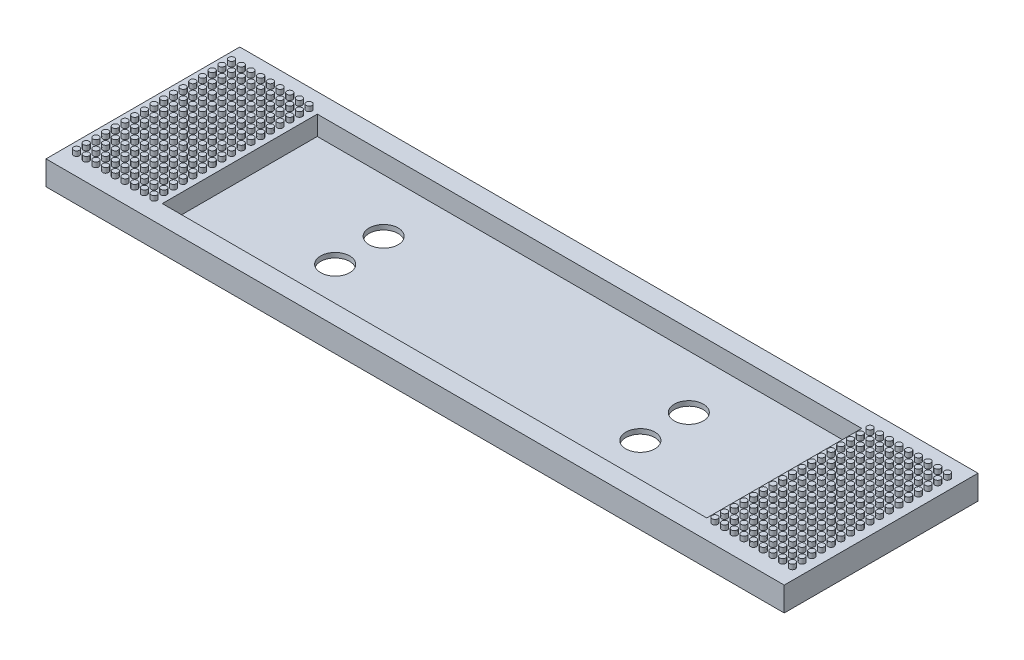
from build123d import *

# Parameters (mm, degrees)
SKETCH1_W           = 193.548
SKETCH1_H           = 50.8
BOSS_EXTRUDE1_DEPTH = 6.35
SKETCH4_W           = 142.748
SKETCH4_H           = 40.64
CUT_EXTRUDE2_DEPTH  = 5.08
SKETCH5_R           = 0.762
BOSS_EXTRUDE2_DEPTH = 1.27
SKETCH6_R           = 3.81
CUT_EXTRUDE3_DEPTH  = 201.248677159


with BuildPart() as part:
    # Sketch1 → Boss-Extrude1 (new body)
    with BuildSketch(Plane(origin=(0, 0, 0), x_dir=(1, 0, 0), z_dir=(0, 1, 0))):
        with Locations((96.774, 25.4)):
            Rectangle(SKETCH1_W, SKETCH1_H)
    extrude(amount=BOSS_EXTRUDE1_DEPTH)

    # Sketch4 → Cut-Extrude2 (cut)
    with BuildSketch(Plane(origin=(0, 6.35, 0), x_dir=(1, 0, 0), z_dir=(0, 1, 0))):
        with Locations((96.774, 25.4)):
            Rectangle(SKETCH4_W, SKETCH4_H)
    extrude(amount=-CUT_EXTRUDE2_DEPTH, mode=Mode.SUBTRACT)

    # Sketch5 → Boss-Extrude2 (add)
    with BuildSketch(Plane(origin=(0, 6.35, 0), x_dir=(1, 0, 0), z_dir=(0, 1, 0))):
        with Locations((2.937134126, 45.72)):
            Circle(SKETCH5_R)
        with Locations((5.477134126, 45.72)):
            Circle(SKETCH5_R)
        with Locations((8.017134126, 45.72)):
            Circle(SKETCH5_R)
        with Locations((10.557134126, 45.72)):
            Circle(SKETCH5_R)
        with Locations((13.097134126, 45.72)):
            Circle(SKETCH5_R)
        with Locations((15.637134126, 45.72)):
            Circle(SKETCH5_R)
        with Locations((18.177134126, 45.72)):
            Circle(SKETCH5_R)
        with Locations((20.717134126, 45.72)):
            Circle(SKETCH5_R)
        with Locations((23.257134126, 45.72)):
            Circle(SKETCH5_R)
        with Locations((5.477134126, 43.18)):
            Circle(SKETCH5_R)
        with Locations((8.017134126, 43.18)):
            Circle(SKETCH5_R)
        with Locations((10.557134126, 43.18)):
            Circle(SKETCH5_R)
        with Locations((13.097134126, 43.18)):
            Circle(SKETCH5_R)
        with Locations((15.637134126, 43.18)):
            Circle(SKETCH5_R)
        with Locations((18.177134126, 43.18)):
            Circle(SKETCH5_R)
        with Locations((20.717134126, 43.18)):
            Circle(SKETCH5_R)
        with Locations((23.257134126, 43.18)):
            Circle(SKETCH5_R)
        with Locations((5.477134126, 40.64)):
            Circle(SKETCH5_R)
        with Locations((8.017134126, 40.64)):
            Circle(SKETCH5_R)
        with Locations((10.557134126, 40.64)):
            Circle(SKETCH5_R)
        with Locations((13.097134126, 40.64)):
            Circle(SKETCH5_R)
        with Locations((15.637134126, 40.64)):
            Circle(SKETCH5_R)
        with Locations((18.177134126, 40.64)):
            Circle(SKETCH5_R)
        with Locations((20.717134126, 40.64)):
            Circle(SKETCH5_R)
        with Locations((23.257134126, 40.64)):
            Circle(SKETCH5_R)
        with Locations((5.477134126, 38.1)):
            Circle(SKETCH5_R)
        with Locations((8.017134126, 38.1)):
            Circle(SKETCH5_R)
        with Locations((10.557134126, 38.1)):
            Circle(SKETCH5_R)
        with Locations((13.097134126, 38.1)):
            Circle(SKETCH5_R)
        with Locations((15.637134126, 38.1)):
            Circle(SKETCH5_R)
        with Locations((18.177134126, 38.1)):
            Circle(SKETCH5_R)
        with Locations((20.717134126, 38.1)):
            Circle(SKETCH5_R)
        with Locations((23.257134126, 38.1)):
            Circle(SKETCH5_R)
        with Locations((5.477134126, 35.56)):
            Circle(SKETCH5_R)
        with Locations((8.017134126, 35.56)):
            Circle(SKETCH5_R)
        with Locations((10.557134126, 35.56)):
            Circle(SKETCH5_R)
        with Locations((13.097134126, 35.56)):
            Circle(SKETCH5_R)
        with Locations((15.637134126, 35.56)):
            Circle(SKETCH5_R)
        with Locations((18.177134126, 35.56)):
            Circle(SKETCH5_R)
        with Locations((20.717134126, 35.56)):
            Circle(SKETCH5_R)
        with Locations((23.257134126, 35.56)):
            Circle(SKETCH5_R)
        with Locations((5.477134126, 33.02)):
            Circle(SKETCH5_R)
        with Locations((8.017134126, 33.02)):
            Circle(SKETCH5_R)
        with Locations((10.557134126, 33.02)):
            Circle(SKETCH5_R)
        with Locations((13.097134126, 33.02)):
            Circle(SKETCH5_R)
        with Locations((15.637134126, 33.02)):
            Circle(SKETCH5_R)
        with Locations((18.177134126, 33.02)):
            Circle(SKETCH5_R)
        with Locations((20.717134126, 33.02)):
            Circle(SKETCH5_R)
        with Locations((23.257134126, 33.02)):
            Circle(SKETCH5_R)
        with Locations((5.477134126, 30.48)):
            Circle(SKETCH5_R)
        with Locations((8.017134126, 30.48)):
            Circle(SKETCH5_R)
        with Locations((10.557134126, 30.48)):
            Circle(SKETCH5_R)
        with Locations((13.097134126, 30.48)):
            Circle(SKETCH5_R)
        with Locations((15.637134126, 30.48)):
            Circle(SKETCH5_R)
        with Locations((18.177134126, 30.48)):
            Circle(SKETCH5_R)
        with Locations((20.717134126, 30.48)):
            Circle(SKETCH5_R)
        with Locations((23.257134126, 30.48)):
            Circle(SKETCH5_R)
        with Locations((5.477134126, 27.94)):
            Circle(SKETCH5_R)
        with Locations((8.017134126, 27.94)):
            Circle(SKETCH5_R)
        with Locations((10.557134126, 27.94)):
            Circle(SKETCH5_R)
        with Locations((13.097134126, 27.94)):
            Circle(SKETCH5_R)
        with Locations((15.637134126, 27.94)):
            Circle(SKETCH5_R)
        with Locations((18.177134126, 27.94)):
            Circle(SKETCH5_R)
        with Locations((20.717134126, 27.94)):
            Circle(SKETCH5_R)
        with Locations((23.257134126, 27.94)):
            Circle(SKETCH5_R)
        with Locations((5.477134126, 25.4)):
            Circle(SKETCH5_R)
        with Locations((8.017134126, 25.4)):
            Circle(SKETCH5_R)
        with Locations((10.557134126, 25.4)):
            Circle(SKETCH5_R)
        with Locations((13.097134126, 25.4)):
            Circle(SKETCH5_R)
        with Locations((15.637134126, 25.4)):
            Circle(SKETCH5_R)
        with Locations((18.177134126, 25.4)):
            Circle(SKETCH5_R)
        with Locations((20.717134126, 25.4)):
            Circle(SKETCH5_R)
        with Locations((23.257134126, 25.4)):
            Circle(SKETCH5_R)
        with Locations((5.477134126, 22.86)):
            Circle(SKETCH5_R)
        with Locations((8.017134126, 22.86)):
            Circle(SKETCH5_R)
        with Locations((10.557134126, 22.86)):
            Circle(SKETCH5_R)
        with Locations((13.097134126, 22.86)):
            Circle(SKETCH5_R)
        with Locations((15.637134126, 22.86)):
            Circle(SKETCH5_R)
        with Locations((18.177134126, 22.86)):
            Circle(SKETCH5_R)
        with Locations((20.717134126, 22.86)):
            Circle(SKETCH5_R)
        with Locations((23.257134126, 22.86)):
            Circle(SKETCH5_R)
        with Locations((5.477134126, 20.32)):
            Circle(SKETCH5_R)
        with Locations((8.017134126, 20.32)):
            Circle(SKETCH5_R)
        with Locations((10.557134126, 20.32)):
            Circle(SKETCH5_R)
        with Locations((13.097134126, 20.32)):
            Circle(SKETCH5_R)
        with Locations((15.637134126, 20.32)):
            Circle(SKETCH5_R)
        with Locations((18.177134126, 20.32)):
            Circle(SKETCH5_R)
        with Locations((20.717134126, 20.32)):
            Circle(SKETCH5_R)
        with Locations((23.257134126, 20.32)):
            Circle(SKETCH5_R)
        with Locations((5.477134126, 17.78)):
            Circle(SKETCH5_R)
        with Locations((8.017134126, 17.78)):
            Circle(SKETCH5_R)
        with Locations((10.557134126, 17.78)):
            Circle(SKETCH5_R)
        with Locations((13.097134126, 17.78)):
            Circle(SKETCH5_R)
        with Locations((15.637134126, 17.78)):
            Circle(SKETCH5_R)
        with Locations((18.177134126, 17.78)):
            Circle(SKETCH5_R)
        with Locations((20.717134126, 17.78)):
            Circle(SKETCH5_R)
        with Locations((23.257134126, 17.78)):
            Circle(SKETCH5_R)
        with Locations((5.477134126, 15.24)):
            Circle(SKETCH5_R)
        with Locations((8.017134126, 15.24)):
            Circle(SKETCH5_R)
        with Locations((10.557134126, 15.24)):
            Circle(SKETCH5_R)
        with Locations((13.097134126, 15.24)):
            Circle(SKETCH5_R)
        with Locations((15.637134126, 15.24)):
            Circle(SKETCH5_R)
        with Locations((18.177134126, 15.24)):
            Circle(SKETCH5_R)
        with Locations((20.717134126, 15.24)):
            Circle(SKETCH5_R)
        with Locations((23.257134126, 15.24)):
            Circle(SKETCH5_R)
        with Locations((5.477134126, 12.7)):
            Circle(SKETCH5_R)
        with Locations((8.017134126, 12.7)):
            Circle(SKETCH5_R)
        with Locations((10.557134126, 12.7)):
            Circle(SKETCH5_R)
        with Locations((13.097134126, 12.7)):
            Circle(SKETCH5_R)
        with Locations((15.637134126, 12.7)):
            Circle(SKETCH5_R)
        with Locations((18.177134126, 12.7)):
            Circle(SKETCH5_R)
        with Locations((20.717134126, 12.7)):
            Circle(SKETCH5_R)
        with Locations((23.257134126, 12.7)):
            Circle(SKETCH5_R)
        with Locations((5.477134126, 10.16)):
            Circle(SKETCH5_R)
        with Locations((8.017134126, 10.16)):
            Circle(SKETCH5_R)
        with Locations((10.557134126, 10.16)):
            Circle(SKETCH5_R)
        with Locations((13.097134126, 10.16)):
            Circle(SKETCH5_R)
        with Locations((15.637134126, 10.16)):
            Circle(SKETCH5_R)
        with Locations((18.177134126, 10.16)):
            Circle(SKETCH5_R)
        with Locations((20.717134126, 10.16)):
            Circle(SKETCH5_R)
        with Locations((23.257134126, 10.16)):
            Circle(SKETCH5_R)
        with Locations((5.477134126, 7.62)):
            Circle(SKETCH5_R)
        with Locations((8.017134126, 7.62)):
            Circle(SKETCH5_R)
        with Locations((10.557134126, 7.62)):
            Circle(SKETCH5_R)
        with Locations((13.097134126, 7.62)):
            Circle(SKETCH5_R)
        with Locations((15.637134126, 7.62)):
            Circle(SKETCH5_R)
        with Locations((18.177134126, 7.62)):
            Circle(SKETCH5_R)
        with Locations((20.717134126, 7.62)):
            Circle(SKETCH5_R)
        with Locations((23.257134126, 7.62)):
            Circle(SKETCH5_R)
        with Locations((5.477134126, 5.08)):
            Circle(SKETCH5_R)
        with Locations((8.017134126, 5.08)):
            Circle(SKETCH5_R)
        with Locations((10.557134126, 5.08)):
            Circle(SKETCH5_R)
        with Locations((13.097134126, 5.08)):
            Circle(SKETCH5_R)
        with Locations((15.637134126, 5.08)):
            Circle(SKETCH5_R)
        with Locations((18.177134126, 5.08)):
            Circle(SKETCH5_R)
        with Locations((20.717134126, 5.08)):
            Circle(SKETCH5_R)
        with Locations((23.257134126, 5.08)):
            Circle(SKETCH5_R)
        with Locations((2.937134126, 43.18)):
            Circle(SKETCH5_R)
        with Locations((2.937134126, 40.64)):
            Circle(SKETCH5_R)
        with Locations((2.937134126, 38.1)):
            Circle(SKETCH5_R)
        with Locations((2.937134126, 35.56)):
            Circle(SKETCH5_R)
        with Locations((2.937134126, 33.02)):
            Circle(SKETCH5_R)
        with Locations((2.937134126, 30.48)):
            Circle(SKETCH5_R)
        with Locations((2.937134126, 27.94)):
            Circle(SKETCH5_R)
        with Locations((2.937134126, 25.4)):
            Circle(SKETCH5_R)
        with Locations((2.937134126, 22.86)):
            Circle(SKETCH5_R)
        with Locations((2.937134126, 20.32)):
            Circle(SKETCH5_R)
        with Locations((2.937134126, 17.78)):
            Circle(SKETCH5_R)
        with Locations((2.937134126, 15.24)):
            Circle(SKETCH5_R)
        with Locations((2.937134126, 12.7)):
            Circle(SKETCH5_R)
        with Locations((2.937134126, 10.16)):
            Circle(SKETCH5_R)
        with Locations((2.937134126, 7.62)):
            Circle(SKETCH5_R)
        with Locations((2.937134126, 5.08)):
            Circle(SKETCH5_R)
    boss_extrude2 = extrude(amount=BOSS_EXTRUDE2_DEPTH)

    # Mirror1: Boss-Extrude2 across plane
    add(boss_extrude2.mirror(Plane(origin=(96.774, 0, 0), x_dir=(0, 0, 1), z_dir=(1, 0, 0))))

    # Sketch6 → Cut-Extrude3 (cut, through all)
    with BuildSketch(Plane.XZ):
        with Locations((56.769, -31.75)):
            Circle(SKETCH6_R)
        with Locations((56.769, -19.05)):
            Circle(SKETCH6_R)
    cut_extrude3 = extrude(amount=-CUT_EXTRUDE3_DEPTH, mode=Mode.SUBTRACT)

    # Mirror3: Cut-Extrude3 across plane
    add(cut_extrude3.mirror(Plane(origin=(96.774, 0, 0), x_dir=(0, 0, 1), z_dir=(1, 0, 0))), mode=Mode.SUBTRACT)


solid = part.part
